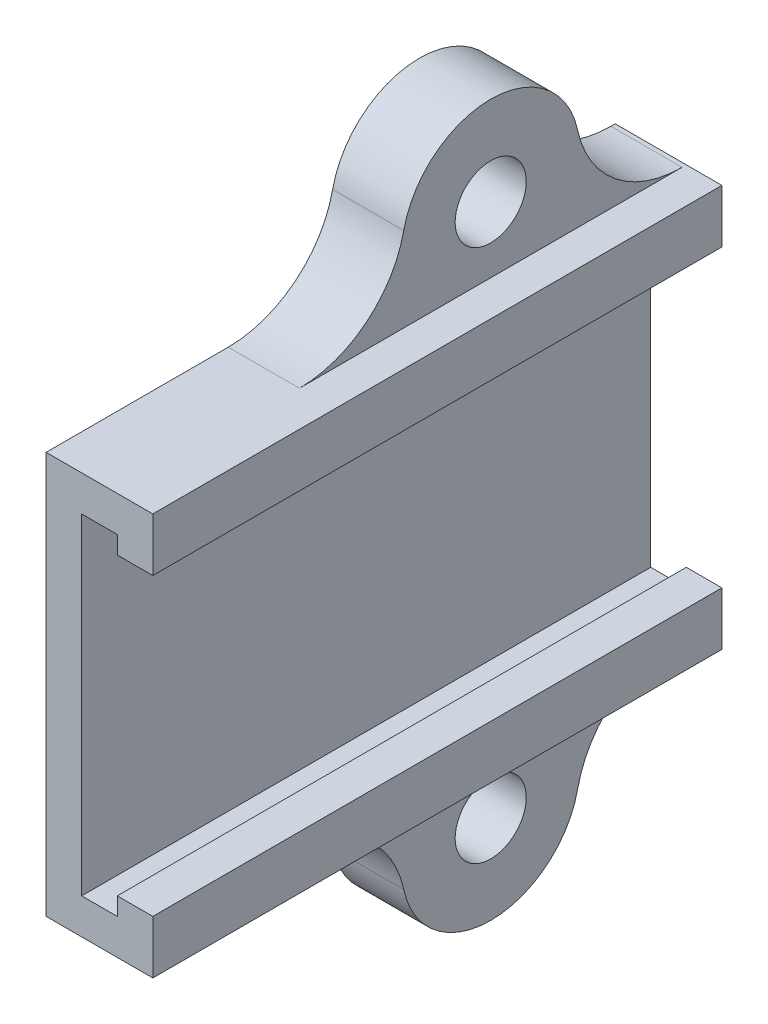
from build123d import *

# Parameters (mm, degrees)
BOSS_EXTRU_1_DEPTH = 32
ESQUISSE2_R        = 2
BOSS_EXTRU_2_DEPTH = 4
CONG_1_R           = 6


with BuildPart() as part:
    # Esquisse1 → Boss.-Extru.1 (new body)
    with BuildSketch(Plane.XY):
        Polygon((4, -2), (4, 1), (2, 1), (2, 0), (0, 0), (0, 18.6), (2, 18.6), (2, 17.6), (4, 17.6), (4, 20.6), (-2, 20.6), (-2, -2), align=None)
    extrude(amount=BOSS_EXTRU_1_DEPTH)

    # Esquisse2 → Boss.-Extru.2 (add)
    # profile 1 of 2: a face of its own
    with BuildSketch(Plane.ZY.offset(2)):
        with BuildLine():
            Line((6, -2), (6, -5.7))
            ThreePointArc((6, -5.7), (11, -10.7), (16, -5.7))
            Line((16, -5.7), (16, -2))
            Line((16, -2), (6, -2))
        make_face()
        with Locations((11, -5.7)):
            Circle(ESQUISSE2_R, mode=Mode.SUBTRACT)
    # profile 2 of 2: a face of its own
    with BuildSketch(Plane.ZY.offset(2)):
        with BuildLine():
            Line((6, 20.6), (6, 24.3))
            ThreePointArc((6, 24.3), (11, 29.3), (16, 24.3))
            Line((16, 24.3), (16, 20.6))
            Line((16, 20.6), (6, 20.6))
        make_face()
        with Locations((11, 24.3)):
            Circle(ESQUISSE2_R, mode=Mode.SUBTRACT)
    extrude(amount=-BOSS_EXTRU_2_DEPTH)

    # Congé1
    # the kernel refuses this fillet: 6 mm, written as the material it adds along each edge
    with BuildSketch(Plane(origin=(-2, -2, 16), x_dir=(0, 0, 1), z_dir=(1, 0, 0)), Plane(origin=(-2, 20.6, 6), x_dir=(0, 0, -1), z_dir=(1, 0, 0))) as cong_1_piece_1:
        with BuildLine():
            CenterArc((5.756858277, 6), CONG_1_R, 192.069082524, 77.930917476)
            Line((-0.110518965, 4.745454545), (-0.697256689, 4.62))
            ThreePointArc((-0.697256689, 4.62), (-0.6, 3.7), (-0.6, 0))
            Line((-0.6, 0), (0, -0.6))
            Line((0, -0.6), (5.756858277, -0.6))
            Line((5.756858277, -0.6), (5.756858277, 0))
        make_face()
    extrude(amount=4)
    with BuildSketch(Plane(origin=(-2, 20.6, 16), x_dir=(0, 0, 1), z_dir=(1, 0, 0)), Plane(origin=(-2, -2, 6), x_dir=(0, 0, -1), z_dir=(1, 0, 0))) as cong_1_piece_2:
        with BuildLine():
            CenterArc((5.756858277, -6), CONG_1_R, 90, 77.930917476)
            Line((-0.110518965, -4.745454545), (-0.697256689, -4.62))
            ThreePointArc((-0.697256689, -4.62), (-0.6, -3.7), (-0.6, 0))
            Line((-0.6, 0), (0, 0.6))
            Line((0, 0.6), (5.756858277, 0.6))
            Line((5.756858277, 0.6), (5.756858277, 0))
        make_face()
    extrude(amount=4)


solid = part.part
